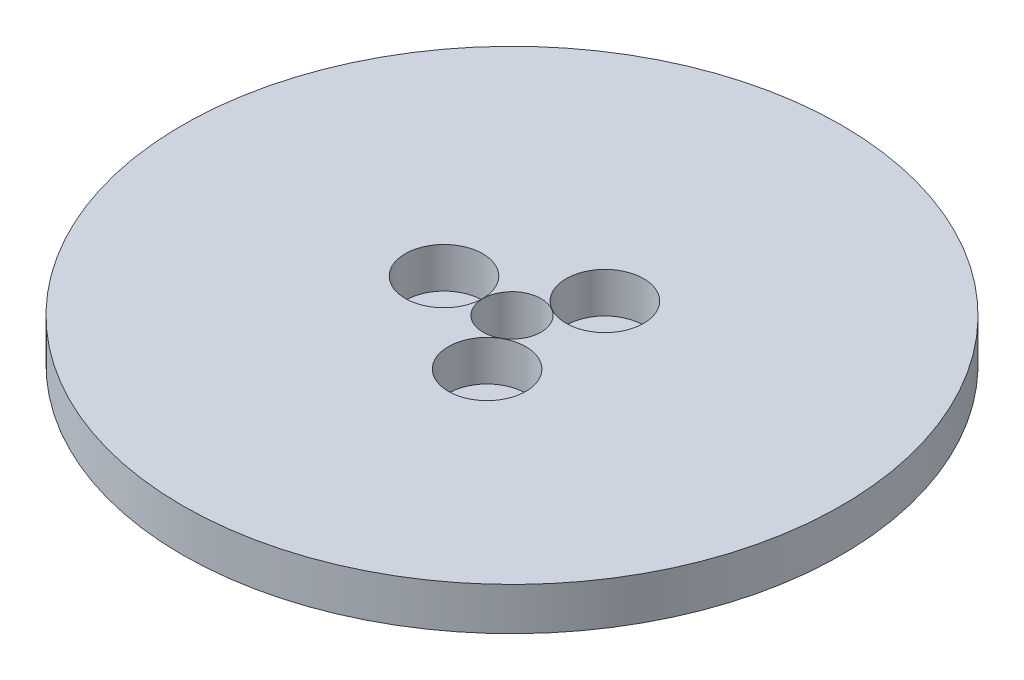
from build123d import *

# Parameters (mm, degrees)
SKETCH1_R           = 85
BOSS_EXTRUDE1_DEPTH = 11
SKETCH2_R           = 7.5
CUT_EXTRUDE1_DEPTH  = 121.710397232
SKETCH3_R           = 10
CUT_EXTRUDE2_DEPTH  = 10.412102657
CIRPATTERN1_COUNT   = 3


with BuildPart() as part:
    # Sketch1 → Boss-Extrude1 (new body)
    with BuildSketch(Plane(origin=(0, 0, 0), x_dir=(1, 0, 0), z_dir=(0, 1, 0))):
        Circle(SKETCH1_R)
    extrude(amount=BOSS_EXTRUDE1_DEPTH)

    # Sketch2 → Cut-Extrude1 (cut, through all)
    with BuildSketch(Plane(origin=(0, 0, 0), x_dir=(1, 0, 0), z_dir=(0, 1, 0))):
        Circle(SKETCH2_R)
    extrude(amount=CUT_EXTRUDE1_DEPTH, mode=Mode.SUBTRACT)

    # Sketch3 → Cut-Extrude2 (cut)
    with BuildSketch(Plane(origin=(0, 11, 0), x_dir=(1, 0, 0), z_dir=(0, 1, 0))):
        with Locations((-17.5399615, 0)):
            Circle(SKETCH3_R)
    cut_extrude2 = extrude(amount=-CUT_EXTRUDE2_DEPTH, mode=Mode.SUBTRACT)

    # CirPattern1: Cut-Extrude2 ×3 about axis
    cirpattern1_axis = Axis((0, 0, 0), (0, 1, 0))
    for i in range(1, CIRPATTERN1_COUNT):
        add(cut_extrude2.rotate(cirpattern1_axis, i * 360 / CIRPATTERN1_COUNT), mode=Mode.SUBTRACT)


solid = part.part
